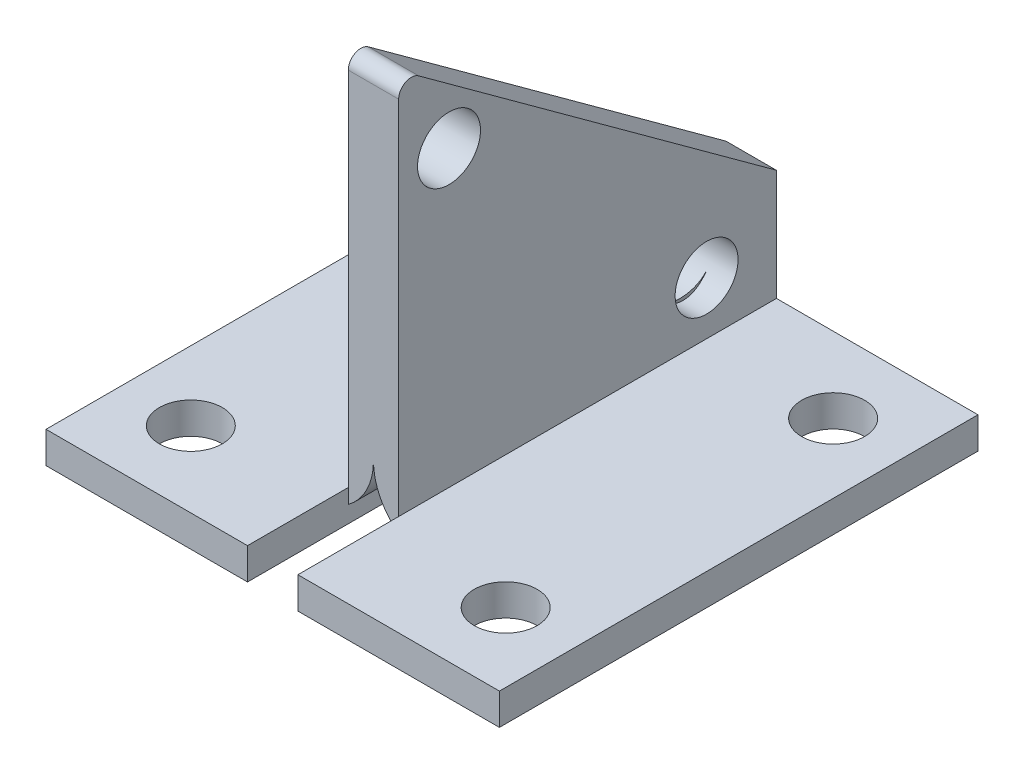
from build123d import *

# Parameters (mm, degrees)
SKETCH1_R            = 2.5
BOSS_EXTRUDE2_DEPTH  = 2
BOSS_EXTRUDE4_DEPTH  = 16
FILLET1_R            = 5
FILLET1_OF_MIRROR1_R = 5
SKETCH3_R            = 2.5
CUT_EXTRUDE2_DEPTH   = 78.57995838
FILLET2_R            = 1


with BuildPart() as part:
    # Sketch1 → Boss-Extrude2 (new body)
    with BuildSketch(Plane(origin=(0, 0, 0), x_dir=(0, 0, -1), z_dir=(1, 0, 0))):
        Polygon((-60.951444932, 12.55580533), (-30.968352486, -9.282744271), (-30.951444932, -19.282744271), (-60.951444932, -19.282744271), align=None)
        with Locations(Location((-36.501270434, -13.912745065, 0), (0, 0, 180))):
            Circle(SKETCH1_R, mode=Mode.SUBTRACT)
        with Locations(Location((-56.951444932, 5.21290167, 0), (0, 0, 180))):
            Circle(SKETCH1_R, mode=Mode.SUBTRACT)
    boss_extrude2 = extrude(amount=BOSS_EXTRUDE2_DEPTH)

    # Sketch2 → Boss-Extrude4 (add)
    with BuildSketch(Plane(origin=(2, 0, 0), x_dir=(0, 0, -1), z_dir=(1, 0, 0))):
        Polygon((-68.951444932, -20.609291835), (-68.951444932, -19.609291835), (-68.951444932, -18.109291835), (-30.953428953, -18.109291835), (-30.951444932, -19.282744271), (-30.951444932, -20.609291835), align=None)
    boss_extrude4 = extrude(amount=BOSS_EXTRUDE4_DEPTH)

    # Fillet1
    # the kernel refuses this fillet: 5 mm, written as the material it takes off along each edge
    with BuildSketch(Plane(origin=(0, -19.282744271, 20.951444932), x_dir=(0, 1, 0), z_dir=(0, 0, 1))) as fillet1_piece_1:
        with BuildLine():
            CenterArc((4, -5), FILLET1_R, 90, 53.130102354)
            Line((0, -2), (-0.08, -1.94))
            ThreePointArc((-0.08, -1.94), (-0.1, -1), (-0.1, 0))
            Line((-0.1, 0), (0, 0.1))
            Line((0, 0.1), (4, 0.1))
            Line((4, 0.1), (4, 0))
        make_face()
    extrude(amount=50, mode=Mode.SUBTRACT)


with BuildPart() as mirror1_1:
    # Mirror1: Boss-Extrude2, Boss-Extrude4 across plane
    add(boss_extrude2.mirror(Plane(origin=(0, 0, 0), x_dir=(0, 0, 1), z_dir=(1, 0, 0))))
    add(boss_extrude4.mirror(Plane(origin=(0, 0, 0), x_dir=(0, 0, 1), z_dir=(1, 0, 0))))

    # Fillet1 of Mirror1
    # the kernel refuses this fillet: 5 mm, written as the material it takes off along each edge
    with BuildSketch(Plane(origin=(0, -19.282744271, 20.951444932), x_dir=(0, 1, 0), z_dir=(0, 0, 1))) as fillet1_of_mirror1_piece_1:
        with BuildLine():
            CenterArc((4, 5), FILLET1_OF_MIRROR1_R, 216.869897646, 53.130102354)
            Line((0, 2), (-0.08, 1.94))
            ThreePointArc((-0.08, 1.94), (-0.1, 1), (-0.1, 0))
            Line((-0.1, 0), (0, -0.1))
            Line((0, -0.1), (4, -0.1))
            Line((4, -0.1), (4, 0))
        make_face()
    extrude(amount=50, mode=Mode.SUBTRACT)


with BuildPart() as part_1:
    add(part.part)

    # Mirror1 united with what the copies touc: union Mirror1_1
    add(mirror1_1.part)

    # Sketch3 → Cut-Extrude2 (cut, through all)
    with BuildSketch(Plane(origin=(0, -18.109291835, 0), x_dir=(1, 0, 0), z_dir=(0, 1, 0))):
        with Locations(Location((12.5, -62.953428953, 0), (0, 0, 270))):
            Circle(SKETCH3_R)
        with Locations(Location((12.5, -36.953428953, 0), (0, 0, 270))):
            Circle(SKETCH3_R)
    cut_extrude2 = extrude(amount=-CUT_EXTRUDE2_DEPTH, mode=Mode.SUBTRACT)

    # Mirror2: Cut-Extrude2 across plane
    add(cut_extrude2.mirror(Plane(origin=(0, 0, 0), x_dir=(0, 0, 1), z_dir=(1, 0, 0))), mode=Mode.SUBTRACT)

    # Fillet2
    fillet2_edges = [part_1.edges().sort_by_distance(p)[0] for p in [
        (0, 12.55580533, 60.951444932),
    ]]
    fillet(fillet2_edges, radius=FILLET2_R)


solid = part_1.part
